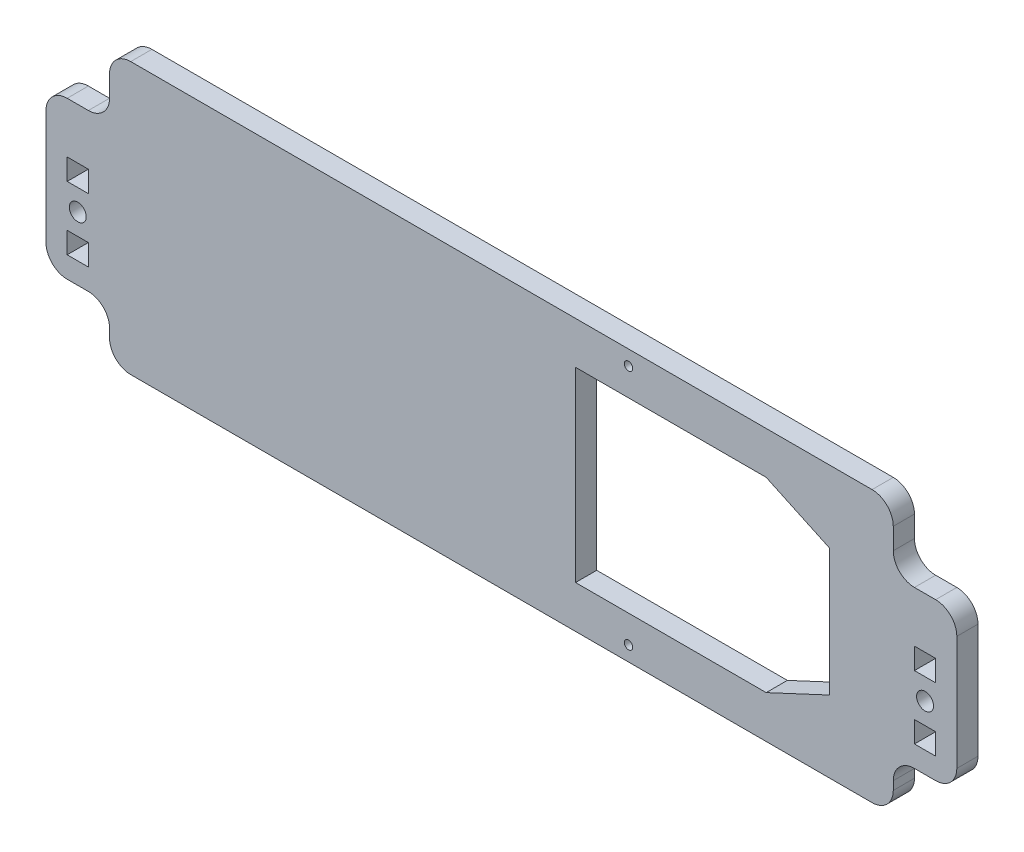
from build123d import *

# Parameters (mm, degrees)
ESQUISSE1_R        = 1
ESQUISSE1_R_2      = 2
ESQUISSE1_W        = 5
ESQUISSE1_H        = 5
BOSS_EXTRU_1_DEPTH = 5
CONG_1_R           = 5


with BuildPart() as part:
    # Esquisse1 → Boss.-Extru.1 (new body)
    with BuildSketch(Plane.XY):
        Polygon((-107.5, 17), (-107.5, -20), (-92.5, -20), (-92.5, -32), (92.5, -32), (92.5, -20), (107.5, -20), (107.5, 17), (92.5, 17), (92.5, 32), (-92.5, 32), (-92.5, 17), align=None)
        with Locations((30, 28.5)):
            Circle(ESQUISSE1_R, mode=Mode.SUBTRACT)
        with Locations((30, -28.5)):
            Circle(ESQUISSE1_R, mode=Mode.SUBTRACT)
        with Locations((100, -5)):
            Circle(ESQUISSE1_R_2, mode=Mode.SUBTRACT)
        with Locations((-100, -5)):
            Circle(ESQUISSE1_R_2, mode=Mode.SUBTRACT)
        Polygon((62.5, 22), (77.5, 15), (77.5, -15), (62.5, -22), (17.5, -22), (17.5, 22), align=None, mode=Mode.SUBTRACT)
        with Locations((100, -12.5)):
            Rectangle(ESQUISSE1_W, ESQUISSE1_H, mode=Mode.SUBTRACT)
        with Locations((100, 2.5)):
            Rectangle(ESQUISSE1_W, ESQUISSE1_H, mode=Mode.SUBTRACT)
        with Locations((-100, -12.5)):
            Rectangle(ESQUISSE1_W, ESQUISSE1_H, mode=Mode.SUBTRACT)
        with Locations((-100, 2.5)):
            Rectangle(ESQUISSE1_W, ESQUISSE1_H, mode=Mode.SUBTRACT)
    extrude(amount=BOSS_EXTRU_1_DEPTH)

    # Congé1
    cong_1_edges = [part.edges().sort_by_distance(p)[0] for p in [
        (-92.5, -20, 2.5),
        (-92.5, 17, 2.5),
        (92.5, 17, 2.5),
        (92.5, -20, 2.5),
        (107.5, -20, 2.5),
        (107.5, 17, 2.5),
        (92.5, -32, 2.5),
        (-92.5, -32, 2.5),
        (-107.5, -20, 2.5),
        (-107.5, 17, 2.5),
        (-92.5, 32, 2.5),
        (92.5, 32, 2.5),
    ]]
    fillet(cong_1_edges, radius=CONG_1_R)


solid = part.part
